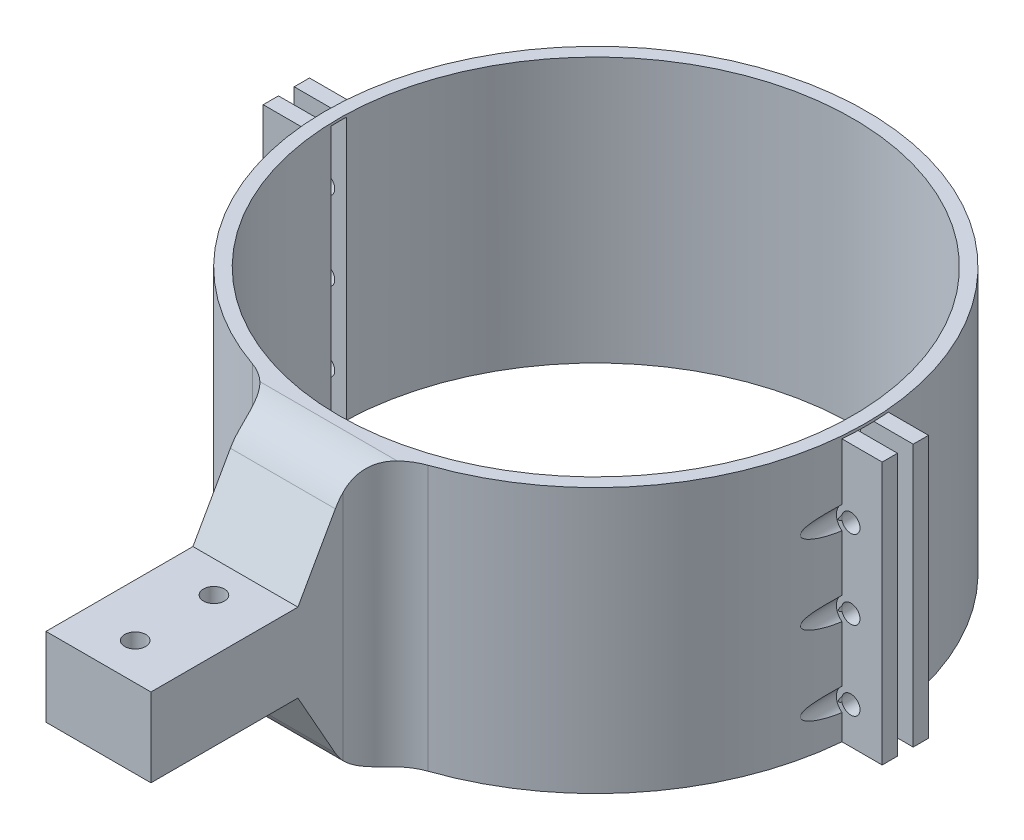
from build123d import *
from build123d.topology import SkipClean

# Parameters (mm, degrees)
BOSS_EXTRUDE1_DEPTH      = 50
BOSS_EXTRUDE1_2_DEPTH    = 50
SKETCH2_R                = 1.7500000000000036
SKETCH2_R_2              = 1.7500000000000038
CUT_EXTRUDE1_DEPTH       = 96.4164046100137
CUT_EXTRUDE3_START       = 50
SKETCH3_R                = 2.750000000000002
SKETCH3_R_2              = 1.7500000000000038
SKETCH3_R_3              = 2.7500000000000018
SKETCH3_R_4              = 1.7500000000000036
SKETCH3_R_5              = 2.750000000000009
SKETCH3_R_6              = 2.7500000000000084
CUT_EXTRUDE3_DEPTH       = 50
SKETCH5_R                = 2.750000000000002
SKETCH5_R_2              = 1.7500000000002716
SKETCH5_R_3              = 1.7500000000002727
SKETCH5_R_4              = 2.7500000000000018
SKETCH5_R_5              = 1.7500000000002722
SKETCH5_R_6              = 1.7500000000000036
SKETCH5_R_7              = 1.7500000000000038
CUT_EXTRUDE4_DEPTH       = 50
SKETCH11_R               = 51.50000000000001
SKETCH11_R_2             = 49
BOSS_EXTRUDE2_DEPTH      = 0.5
BOSS_EXTRUDE3_DEPTH      = 10
BOSS_EXTRUDE3_DEPTH_BACK = 10
SKETCH14_R               = 2.0000000000000027
SKETCH14_R_2             = 2.000000000000002
CUT_EXTRUDE5_DEPTH       = 117.33197926045244
FILLET1_R                = 10
FILLET2_R                = 10


with BuildPart() as part:
    # Sketch1 → Boss-Extrude1 (new body)
    with BuildSketch(Plane(origin=(0, 0, 0), x_dir=(1, 0, 0), z_dir=(0, 1, 0))):
        with BuildLine():
            Line((-58.977035434987286, -4.410639059145967), (-51.31078115844599, -4.410639059145967))
            ThreePointArc((-51.31078115844599, -4.410639059145967), (3.15e-15, -51.5), (51.31078115844599, -4.410639059145967))
            Line((51.31078115844599, -4.410639059145967), (58.977035434987286, -4.410639059145967))
            Line((58.977035434987286, -4.410639059145967), (58.977035434987286, -1.5))
            Line((58.977035434987286, -1.5), (48.977035434987286, -1.5))
            ThreePointArc((48.977035434987286, -1.5), (3e-15, -49), (-48.977035434987286, -1.5))
            Line((-48.977035434987286, -1.5), (-58.977035434987286, -1.5))
            Line((-58.977035434987286, -1.5), (-58.977035434987286, -4.410639059145967))
        make_face()
    extrude(amount=BOSS_EXTRUDE1_DEPTH)


with BuildPart() as body_2:
    # Sketch1 → Boss-Extrude1 2 (new body)
    with BuildSketch(Plane(origin=(0, 0, 0), x_dir=(1, 0, 0), z_dir=(0, 1, 0))):
        with BuildLine():
            ThreePointArc((51.31078115844599, 4.410639059145967), (-8.28e-15, 51.5), (-51.31078115844599, 4.410639059145967))
            Line((-51.31078115844599, 4.410639059145967), (-58.977035434987286, 4.410639059145967))
            Line((-58.977035434987286, 4.410639059145967), (-58.977035434987286, 1.5))
            Line((-58.977035434987286, 1.5), (-48.977035434987286, 1.5))
            ThreePointArc((-48.977035434987286, 1.5), (3e-15, 49), (48.977035434987286, 1.5))
            Line((48.977035434987286, 1.5), (58.977035434987286, 1.5))
            Line((58.977035434987286, 1.5), (58.977035434987286, 4.410639059145967))
            Line((58.977035434987286, 4.410639059145967), (51.31078115844599, 4.410639059145967))
        make_face()
    extrude(amount=BOSS_EXTRUDE1_2_DEPTH)


with BuildPart() as cut_extrude1_tool:
    # Sketch2 → Cut-Extrude1 (new, through all)
    with BuildSketch(Plane.XY.offset(4.410639059145967)):
        with Locations(Location((-52.99999999999999, 7, 0), (0, 0, 15.144961381))):
            Circle(SKETCH2_R)
        with Locations(Location((-52.999999999999986, 22, 0), (0, 0, 344.855038619))):
            Circle(SKETCH2_R_2)
        with Locations(Location((-52.99999999999999, 37, 0), (0, 0, 344.855038619))):
            Circle(SKETCH2_R_2)
        with Locations((53.00000000000001, 7.000000000000013)):
            Circle(SKETCH2_R)
        with Locations((53, 22.000000000000014)):
            Circle(SKETCH2_R_2)
        with Locations((52.99999999999999, 37.000000000000014)):
            Circle(SKETCH2_R_2)
    extrude(amount=-CUT_EXTRUDE1_DEPTH)


with BuildPart() as part_1:
    add(part.part)

    # Cut-Extrude1: cut by cut_extrude1_tool
    add(cut_extrude1_tool.part, mode=Mode.SUBTRACT)

    # Sketch3 → Cut-Extrude3 (cut)
    # profile 1 of 6: a face of its own
    with BuildSketch(Plane.XY.offset(4.410639059145967).offset(CUT_EXTRUDE3_START)):
        with Locations((-52.99999999999999, 37)):
            Circle(SKETCH3_R)
        with Locations((-52.99999999999999, 37)):
            Circle(SKETCH3_R_2, mode=Mode.SUBTRACT)
    # profile 2 of 6: a face of its own
    with BuildSketch(Plane.XY.offset(4.410639059145967).offset(CUT_EXTRUDE3_START)):
        with Locations((-52.999999999999986, 22)):
            Circle(SKETCH3_R)
        with Locations((-52.999999999999986, 22)):
            Circle(SKETCH3_R_2, mode=Mode.SUBTRACT)
    # profile 3 of 6: a face of its own
    with BuildSketch(Plane.XY.offset(4.410639059145967).offset(CUT_EXTRUDE3_START)):
        with Locations((-52.99999999999999, 7)):
            Circle(SKETCH3_R_3)
        with Locations((-52.99999999999999, 7)):
            Circle(SKETCH3_R_4, mode=Mode.SUBTRACT)
    # profile 4 of 6: a face of its own
    with BuildSketch(Plane.XY.offset(4.410639059145967).offset(CUT_EXTRUDE3_START)):
        with Locations((53.00000000000001, 7.000000000000013)):
            Circle(SKETCH3_R_5)
        with Locations((53.00000000000001, 7.000000000000013)):
            Circle(SKETCH3_R_4, mode=Mode.SUBTRACT)
    # profile 5 of 6: a face of its own
    with BuildSketch(Plane.XY.offset(4.410639059145967).offset(CUT_EXTRUDE3_START)):
        with Locations((53, 22.000000000000014)):
            Circle(SKETCH3_R_6)
        with Locations((53, 22.000000000000014)):
            Circle(SKETCH3_R_2, mode=Mode.SUBTRACT)
    # profile 6 of 6: a face of its own
    with BuildSketch(Plane.XY.offset(4.410639059145967).offset(CUT_EXTRUDE3_START)):
        with Locations((52.99999999999999, 37.000000000000014)):
            Circle(SKETCH3_R_6)
        with Locations((52.99999999999999, 37.000000000000014)):
            Circle(SKETCH3_R_2, mode=Mode.SUBTRACT)
    extrude(amount=-CUT_EXTRUDE3_DEPTH, mode=Mode.SUBTRACT)



with BuildPart() as body_2_1:
    add(body_2.part)

    # Cut-Extrude1: cut by cut_extrude1_tool
    add(cut_extrude1_tool.part, mode=Mode.SUBTRACT)

    # Sketch5 → Cut-Extrude4 (cut)
    # profile 1 of 6: a face of its own
    with BuildSketch(Plane(origin=(0, 0, -4.410639059145967), x_dir=(-1, 0, 0), z_dir=(0, 0, -1))):
        with Locations((-52.99999999999999, 37.000000000000014)):
            Circle(SKETCH5_R)
        with Locations(Location((-52.99999999999999, 37.000000000000014, 0), (0, 0, 180))):
            Circle(SKETCH5_R_2, mode=Mode.SUBTRACT)
    # profile 2 of 6: a face of its own
    with BuildSketch(Plane(origin=(0, 0, -4.410639059145967), x_dir=(-1, 0, 0), z_dir=(0, 0, -1))):
        with Locations((-53, 22.000000000000014)):
            Circle(SKETCH5_R)
        with Locations(Location((-53, 22.000000000000014, 0), (0, 0, 180))):
            Circle(SKETCH5_R_3, mode=Mode.SUBTRACT)
    # profile 3 of 6: a face of its own
    with BuildSketch(Plane(origin=(0, 0, -4.410639059145967), x_dir=(-1, 0, 0), z_dir=(0, 0, -1))):
        with Locations((-53.00000000000001, 7.000000000000013)):
            Circle(SKETCH5_R_4)
        with Locations(Location((-53.00000000000001, 7.000000000000013, 0), (0, 0, 180))):
            Circle(SKETCH5_R_5, mode=Mode.SUBTRACT)
    # profile 4 of 6: a face of its own
    with BuildSketch(Plane(origin=(0, 0, -4.410639059145967), x_dir=(-1, 0, 0), z_dir=(0, 0, -1))):
        with Locations((52.99999999999999, 7)):
            Circle(SKETCH5_R_4)
        with Locations(Location((52.99999999999999, 7, 0), (0, 0, 180))):
            Circle(SKETCH5_R_6, mode=Mode.SUBTRACT)
    # profile 5 of 6: a face of its own
    with BuildSketch(Plane(origin=(0, 0, -4.410639059145967), x_dir=(-1, 0, 0), z_dir=(0, 0, -1))):
        with Locations((52.999999999999986, 22)):
            Circle(SKETCH5_R)
        with Locations(Location((52.999999999999986, 22, 0), (0, 0, 180))):
            Circle(SKETCH5_R_7, mode=Mode.SUBTRACT)
    # profile 6 of 6: a face of its own
    with BuildSketch(Plane(origin=(0, 0, -4.410639059145967), x_dir=(-1, 0, 0), z_dir=(0, 0, -1))):
        with Locations((52.99999999999999, 37)):
            Circle(SKETCH5_R)
        with Locations(Location((52.99999999999999, 37, 0), (0, 0, 180))):
            Circle(SKETCH5_R_7, mode=Mode.SUBTRACT)
    extrude(amount=CUT_EXTRUDE4_DEPTH, mode=Mode.SUBTRACT)


with BuildPart() as part_2:
    with SkipClean():  # the faces are left unmerged after this step: merging them gives an invalid solid
        add(part_1.part)

        add(body_2_1.part)  # Boss-Extrude2 merges body 2
        # Sketch11 → Boss-Extrude2 (add)
        with BuildSketch(Plane(origin=(0, 50, 0), x_dir=(1, 0, 0), z_dir=(0, 1, 0))):
            with Locations(Location((0, 0, 0), (0, 0, 4.913028314))):
                Circle(SKETCH11_R)
            with Locations(Location((0, 0, 0), (0, 0, 1.754226491))):
                Circle(SKETCH11_R_2, mode=Mode.SUBTRACT)
        extrude(amount=BOSS_EXTRUDE2_DEPTH)

    # Sketch13 → Boss-Extrude3 (add, two sides: drawn at the far end of the back side and taken through both)
    with SkipClean():  # the faces are left unmerged after this step: merging them gives an invalid solid
        with BuildSketch(Plane(origin=(0, 0, 0), x_dir=(0, -1, 0), z_dir=(-1, 0, 0)).offset(-BOSS_EXTRUDE3_DEPTH_BACK)):
            Polygon((-50.5, 50.07433990752083), (0, 50.07433990752083), (0, 56.77487105453952), (-17.750000000000004, 66.77487105453952), (-17.750000000000004, 94.7748710545395), (-32.75, 94.7748710545395), (-32.75, 66.77487105453952), (-50.5, 56.77487105453952), align=None)
        extrude(amount=BOSS_EXTRUDE3_DEPTH + BOSS_EXTRUDE3_DEPTH_BACK)

    # Sketch14 → Cut-Extrude5 (cut, through all)
    with SkipClean():  # the faces are left unmerged after this step: merging them gives an invalid solid
        with BuildSketch(Plane(origin=(0, 32.75, 0), x_dir=(1, 0, 0), z_dir=(0, 1, 0))):
            with Locations(Location((7.3e-16, -72.7748710545395, 0), (0, 0, 270))):
                Circle(SKETCH14_R)
            with Locations(Location((2.57e-15, -87.7748710545395, 0), (0, 0, 270))):
                Circle(SKETCH14_R_2)
        extrude(amount=-CUT_EXTRUDE5_DEPTH, mode=Mode.SUBTRACT)

    # Fillet1
    # the kernel refuses this fillet: 10 mm, written as the material it adds along each edge
    with BuildSketch(Plane(origin=(10, 50, 50.51979809935902), x_dir=(0, 0, 1), z_dir=(0, -1, 0))) as fillet1_piece_1_section:
        with BuildLine():
            CenterArc((7.6373166846465566, -10), FILLET1_R, 90, 71.02211059725593)
            ThreePointArc((-1.8191247436470306, -6.747967479674799), (-0.7949627027654316, -3.404877648888572), (0, 0))
            Line((0, 0), (7.6373166846465566, 0))
        make_face()
    fillet1_piece_1 = extrude(amount=50, mode=Mode.PRIVATE)
    fillet1_piece_1 = split(fillet1_piece_1, bisect_by=Plane(origin=(11.489038899176746, 33.23252295829684, 66.50302713437229), z_dir=(0, -0.4908437339407761, -0.8712476277448775)), keep=Keep.TOP, mode=Mode.PRIVATE)
    fillet1_piece_1 = split(fillet1_piece_1, bisect_by=Plane(origin=(11.489038899176746, 16.895529829207, 66.29347940902232), z_dir=(0, 0.490843733940776, -0.8712476277448776)), keep=Keep.TOP, mode=Mode.PRIVATE)
    add(fillet1_piece_1)
    with BuildSketch(Plane(origin=(-10, 50, 50.51979809935902), x_dir=(-0.9655307843998756, 0, -0.26028888638618575), z_dir=(0, -1, 0))) as fillet1_piece_2_section:
        with BuildLine():
            CenterArc((7.667399189173459, -9.976953233098895), FILLET1_R, 93.89068507686385, 71.02211059725603)
            Line((-1.9879086548253004, -7.374064369237051), (0, 0))
            ThreePointArc((0, 0), (3.4944341437383506, -0.11869084954066757), (6.988868287476693, -1.4e-16))
        make_face()
    fillet1_piece_2 = extrude(amount=50, mode=Mode.PRIVATE)
    fillet1_piece_2 = split(fillet1_piece_2, bisect_by=Plane(origin=(-11.48903889916899, 33.232522958377345, 66.50302713432693), z_dir=(0, -0.4908437339407761, -0.8712476277448775)), keep=Keep.TOP, mode=Mode.PRIVATE)
    fillet1_piece_2 = split(fillet1_piece_2, bisect_by=Plane(origin=(-11.48903889916899, 16.89552982928564, 66.29347940906663), z_dir=(0, 0.490843733940776, -0.8712476277448776)), keep=Keep.TOP, mode=Mode.PRIVATE)
    add(fillet1_piece_2)
    with BuildSketch(Plane(origin=(-10, 50.5, 50.519798099359036), x_dir=(-0.9655307843998757, 0, -0.2602888863861861), z_dir=(0, -1, 0))) as fillet1_piece_3_section:
        with BuildLine():
            CenterArc((7.667399189173481, -9.976953233098898), FILLET1_R, 93.89068507686386, 71.02211059725596)
            Line((-1.9879086548252787, -7.374064369237044), (0, 0))
            ThreePointArc((0, 0), (3.4944341437383892, -0.1186908495406642), (6.988868287476714, 4e-17))
        make_face()
    fillet1_piece_3 = extrude(amount=0.5, mode=Mode.PRIVATE)
    fillet1_piece_3 = split(fillet1_piece_3, bisect_by=Plane(origin=(-11.521147213117864, 52.443856086433456, 55.679740864999545), z_dir=(0, -0.4908437339407761, -0.8712476277448775)), keep=Keep.TOP, mode=Mode.PRIVATE)
    add(fillet1_piece_3)
    with BuildSketch(Plane(origin=(10, 50.5, 50.519798099359036), x_dir=(0.9655307843998753, 0, -0.26028888638618725), z_dir=(0, -1, 0))) as fillet1_piece_4_section:
        with BuildLine():
            CenterArc((7.667399189173456, 9.976953233098904), FILLET1_R, 195.08720432588032, 71.02211059725596)
            Line((-1.9879086548252962, 7.374064369237031), (0, 0))
            ThreePointArc((0, 0), (3.494434143738337, 0.11869084954066927), (6.988868287476707, -9e-17))
        make_face()
    fillet1_piece_4 = extrude(amount=0.5, mode=Mode.PRIVATE)
    fillet1_piece_4 = split(fillet1_piece_4, bisect_by=Plane(origin=(11.521147213117855, 52.44385608643343, 55.67974086499956), z_dir=(0, -0.4908437339407761, -0.8712476277448775)), keep=Keep.TOP, mode=Mode.PRIVATE)
    add(fillet1_piece_4)

    # Fillet2
    fillet2_edges = [part_2.edges().sort_by_distance(p)[0] for p in [
        (-1.78e-15, 50.5, 56.77487105454006),
        (9.2548e-13, 0, 56.774871054536426),
    ]]
    fillet(fillet2_edges, radius=FILLET2_R)


solid = part_2.part
